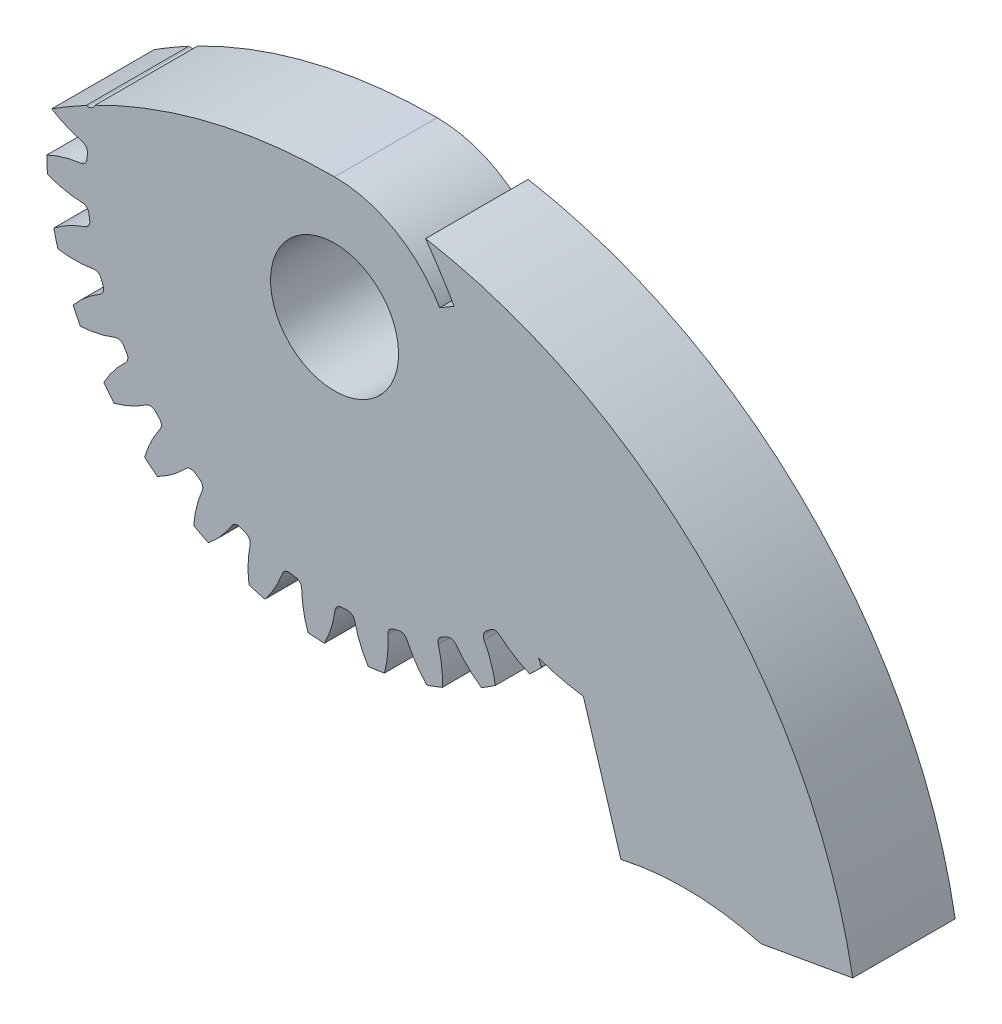
from build123d import *

# Parameters (mm, degrees)
SKETCH3_R               = 40.64
GEARBODY_DEPTH          = 9.652
TOOTHCUT_DEPTH          = 59.278472046
CIRPATTERN1_COUNT       = 30
SCALE1_SCALE_X          = 0.666666667
SCALE1_SCALE_Y          = 0.666666667
SCALE1_SCALE_Z          = 1
BOREDIA_R               = 6.025500014
BORE_DEPTH              = 12700
CUT_EXTRUDE1_DEPTH      = 40.49986663
BOSS_EXTRUDE1_DEPTH     = 9.652
BODY_TUBE_CUT_OUT_DEPTH = 59.606597669


with BuildPart() as part:
    # Sketch3 → gearBody (new body)
    with BuildSketch(Plane.XY):
        Circle(SKETCH3_R)
    extrude(amount=GEARBODY_DEPTH)

    # Sketch2 → toothCut (cut, through all)
    with BuildSketch(Plane.XY):
        with BuildLine():
            ThreePointArc((34.901466352, -2.640387833), (34.929801576, -2.234493965), (34.953416534, -1.828298136))
            ThreePointArc((34.953416534, -1.828298136), (35.218972856, -1.205360668), (35.823821616, -0.900845929))
            ThreePointArc((35.823821616, -0.900845929), (41.902420255, 1.180053047), (46.567899911, 5.597382731))
            ThreePointArc((46.567899911, 5.597382731), (46.807414621, -2.994316622), (45.4750933, -11.485464069))
            ThreePointArc((45.4750933, -11.485464069), (41.410501506, -6.509663078), (35.646600115, -3.671187658))
            ThreePointArc((35.646600115, -3.671187658), (35.08548304, -3.292084932), (34.901466352, -2.640387833))
        make_face()
    toothcut = extrude(amount=TOOTHCUT_DEPTH, mode=Mode.SUBTRACT)

    # CirPattern1: toothCut ×30 about axis
    cirpattern1_axis = Axis((0, 0, 0), (0, 0, 1))
    for i in range(1, CIRPATTERN1_COUNT):
        add(toothcut.rotate(cirpattern1_axis, i * 360 / CIRPATTERN1_COUNT), mode=Mode.SUBTRACT)


with BuildPart() as part_1:
    # Scale1: scaled about (0, 0, 4.826)
    add(part.part.scale((SCALE1_SCALE_X, SCALE1_SCALE_Y, SCALE1_SCALE_Z), about=(0, 0, 4.826)))

    # boreDia → bore (cut, symmetric)
    with BuildSketch(Plane.XY):
        Circle(BOREDIA_R)
    extrude(amount=BORE_DEPTH, both=True, mode=Mode.SUBTRACT)

    # Sketch4 → Cut-Extrude1 (cut, through all)
    with BuildSketch(Plane.XY.offset(9.652)):
        with BuildLine():
            ThreePointArc((-27.126729009, 3.341060233), (0, 11.43), (27.126729009, 3.341060233))
            ThreePointArc((27.126729009, 3.341060233), (0, 27.33170522), (-27.126729009, 3.341060233))
        make_face()
    extrude(amount=-CUT_EXTRUDE1_DEPTH, mode=Mode.SUBTRACT)

    # Sketch5 → Boss-Extrude1 (add)
    with BuildSketch(Plane.XY.offset(9.652)):
        with BuildLine():
            Line((23.424769806, -19.215611802), (26.959165805, -30.742024145))
            ThreePointArc((26.959165805, -30.742024145), (33.569316663, -30.066976699), (40.144948283, -31.021362479))
            Line((40.144948283, -31.021362479), (48.777528007, -29.49920576))
            ThreePointArc((48.777528007, -29.49920576), (34.808245264, -2.863556342), (8.00379846, 10.779035488))
            add(Edge.make_bspline(
                [(8.00379846, 10.779035488), (4.700723166, -16.48766374), (23.424769806, -19.215611802)],
                knots=[0, 0, 0, 1, 1, 1], degree=2))
        make_face()
    extrude(amount=-BOSS_EXTRUDE1_DEPTH)

    # Sketch6 → Body Tube Cut Out (cut, through all)
    with BuildSketch(Plane.XY.offset(9.652)):
        with BuildLine():
            Line((11.262487171, 6.5024), (9.898670365, 5.715))
            ThreePointArc((9.898670365, 5.715), (5.715, 9.898670365), (0, 11.43))
            ThreePointArc((0, 11.43), (4.300943022, 11.242910221), (8.569394121, 10.683054275))
            ThreePointArc((8.569394121, 10.683054275), (9.966823016, 8.625504533), (11.262487171, 6.5024))
        make_face()
    extrude(amount=-BODY_TUBE_CUT_OUT_DEPTH, mode=Mode.SUBTRACT)


solid = part_1.part
